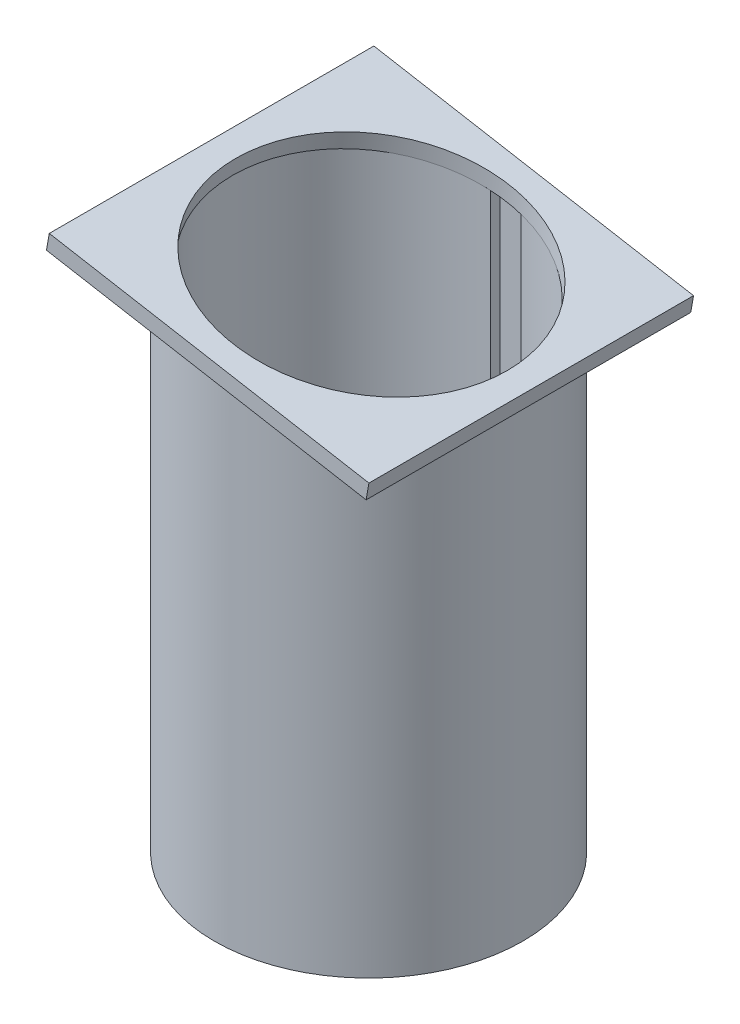
from build123d import *

# Parameters (mm, degrees)
SKETCH2_R           = 47.5
SKETCH2_R_2         = 37.5
BOSS_EXTRUDE2_DEPTH = 5
BOSS_EXTRUDE4_REACH = 297.875
SKETCH1_R           = 47.5
SKETCH9_W           = 100
SKETCH9_H           = 100
SKETCH9_R           = 42.5
BOSS_EXTRUDE7_DEPTH = 5


with BuildPart() as part:
    # Sketch2 → Boss-Extrude2 (new body)
    with BuildSketch(Plane(origin=(0, 0, 0), x_dir=(1, 0, 0), z_dir=(0, 1, 0))):
        Circle(SKETCH2_R)
        Circle(SKETCH2_R_2, mode=Mode.SUBTRACT)
    extrude(amount=BOSS_EXTRUDE2_DEPTH)

    # Boss-Extrude4: up to this plane
    boss_extrude4_end = Plane(origin=(26.04722665, 147.721162952, 0), z_dir=(0.1736481776669304, 0.984807753012208, 0))
    # Sketch1 → Boss-Extrude4 (add, up to the surface)
    with BuildSketch(Plane(origin=(0, 0, 0), x_dir=(1, 0, 0), z_dir=(0, 1, 0)), mode=Mode.PRIVATE) as boss_extrude4_sk1:
        Circle(SKETCH1_R)
        with BuildLine():
            Line((-4.75, -42.233724676), (-4.75, -45.233724676))
            Line((-4.75, -45.233724676), (4.75, -45.233724676))
            Line((4.75, -45.233724676), (4.75, -42.233724676))
            ThreePointArc((4.75, -42.233724676), (42.5, 0), (4.75, 42.233724676))
            Line((4.75, 42.233724676), (4.75, 45.233724676))
            Line((4.75, 45.233724676), (-4.75, 45.233724676))
            Line((-4.75, 45.233724676), (-4.75, 42.233724676))
            ThreePointArc((-4.75, 42.233724676), (-42.5, 0), (-4.75, -42.233724676))
        make_face(mode=Mode.SUBTRACT)
    boss_extrude4_tool1 = split(extrude(boss_extrude4_sk1.sketch, amount=BOSS_EXTRUDE4_REACH, mode=Mode.PRIVATE), bisect_by=boss_extrude4_end, keep=Keep.BOTH, mode=Mode.PRIVATE)
    add(boss_extrude4_tool1.solids().sort_by_distance((-46.156497, 0, 0))[0])

    # Sketch9 → Boss-Extrude7 (add)
    with BuildSketch(Plane(origin=(26.04722665, 147.721162952, 0), x_dir=(0, 0, -1), z_dir=(0.17364817766693041, 0.9848077530122081, 0))):
        with Locations((0, 26.449047106)):
            Rectangle(SKETCH9_W, SKETCH9_H)
        with Locations((0, 26.449047106)):
            Circle(SKETCH9_R, mode=Mode.SUBTRACT)
    extrude(amount=BOSS_EXTRUDE7_DEPTH)


solid = part.part
